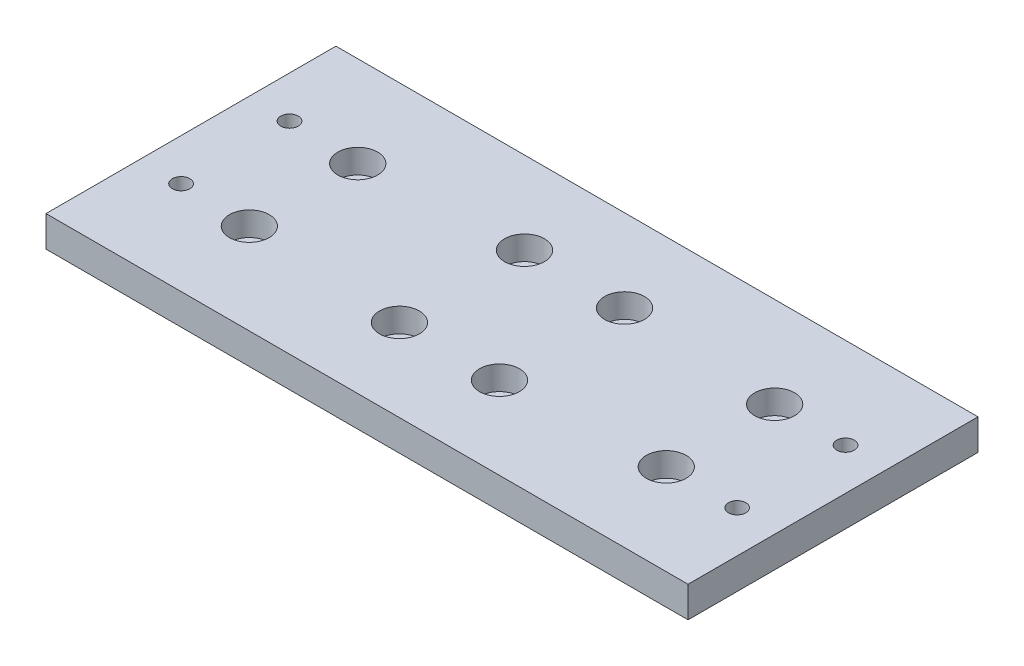
from build123d import *

# Parameters (mm, degrees)
ESBO_O1_W             = 154
ESBO_O1_H             = 69.55
FLANGE_BASE1_DEPTH    = 7.4
ESBO_O6_R             = 4.775
CORTE_EXTRUS_O1_DEPTH = 5.75
ESBO_O8_R             = 2.65
CORTE_EXTRUS_O3_DEPTH = 85.683901215
ESBO_O10_R            = 2.1
CORTE_EXTRUS_O4_DEPTH = 85.811913226


# Sheet-metal steps are written as plain solids
with BuildPart() as part:
    # Esboço1 → Flange-base1 (new body)
    with BuildSketch(Plane(origin=(0, 0, 0), x_dir=(1, 0, 0), z_dir=(0, 1, 0))):
        Rectangle(ESBO_O1_W, ESBO_O1_H)
    extrude(amount=-FLANGE_BASE1_DEPTH)

    # Esboço6 → Corte-extrusão1 (cut)
    with BuildSketch(Plane(origin=(0, 0, 0), x_dir=(1, 0, 0), z_dir=(0, 1, 0))):
        with Locations(Location((-50, 13, 0), (0, 0, 270))):
            Circle(ESBO_O6_R)
        with Locations(Location((-50, -13, 0), (0, 0, 270))):
            Circle(ESBO_O6_R)
        with Locations(Location((-12, 15, 0), (0, 0, 270))):
            Circle(ESBO_O6_R)
        with Locations(Location((12, 15, 0), (0, 0, 270))):
            Circle(ESBO_O6_R)
        with Locations(Location((12, -15, 0), (0, 0, 270))):
            Circle(ESBO_O6_R)
        with Locations(Location((50, 13, 0), (0, 0, 270))):
            Circle(ESBO_O6_R)
        with Locations(Location((50, -13, 0), (0, 0, 270))):
            Circle(ESBO_O6_R)
        with Locations(Location((-12, -15, 0), (0, 0, 270))):
            Circle(ESBO_O6_R)
    extrude(amount=-CORTE_EXTRUS_O1_DEPTH, mode=Mode.SUBTRACT)

    # Esboço8 → Corte-extrusão3 (cut, through all)
    with BuildSketch(Plane(origin=(0, -5.75, 0), x_dir=(1, 0, 0), z_dir=(0, 1, 0))):
        with Locations(Location((-50, 13, 0), (0, 0, 270))):
            Circle(ESBO_O8_R)
        with Locations(Location((-50, -13, 0), (0, 0, 270))):
            Circle(ESBO_O8_R)
        with Locations(Location((-12, 15, 0), (0, 0, 270))):
            Circle(ESBO_O8_R)
        with Locations(Location((12, 15, 0), (0, 0, 270))):
            Circle(ESBO_O8_R)
        with Locations(Location((12, -15, 0), (0, 0, 270))):
            Circle(ESBO_O8_R)
        with Locations(Location((50, 13, 0), (0, 0, 270))):
            Circle(ESBO_O8_R)
        with Locations(Location((50, -13, 0), (0, 0, 270))):
            Circle(ESBO_O8_R)
        with Locations(Location((-12, -15, 0), (0, 0, 270))):
            Circle(ESBO_O8_R)
    extrude(amount=-CORTE_EXTRUS_O3_DEPTH, mode=Mode.SUBTRACT)

    # Esboço10 → Corte-extrusão4 (cut, through all)
    with BuildSketch(Plane(origin=(0, 0, 0), x_dir=(1, 0, 0), z_dir=(0, 1, 0))):
        with Locations(Location((-67, 13.626456062, 0), (0, 0, 270))):
            Circle(ESBO_O10_R)
        with Locations(Location((-67, -12.373543938, 0), (0, 0, 270))):
            Circle(ESBO_O10_R)
        with Locations(Location((67, 13, 0), (0, 0, 270))):
            Circle(ESBO_O10_R)
        with Locations(Location((67, -13, 0), (0, 0, 270))):
            Circle(ESBO_O10_R)
    extrude(amount=-CORTE_EXTRUS_O4_DEPTH, mode=Mode.SUBTRACT)


solid = part.part
